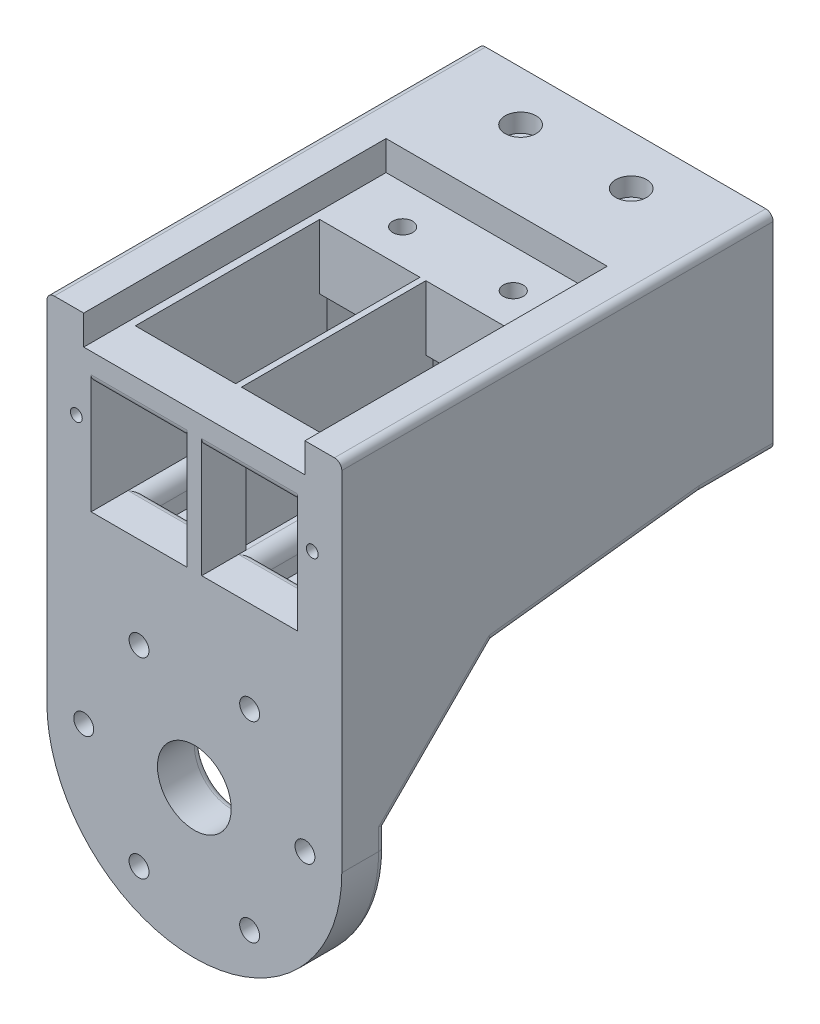
from build123d import *

# Parameters (mm, degrees)
BOSS_EXTRUDE1_DEPTH             = 12
FILLET1_R                       = 40
BOSS_EXTRUDE2_DEPTH             = 105
BOSS_EXTRUDE3_REACH             = 158.228
BOSS_EXTRUDE3_DIRECTION_2_REACH = 158.228
BOSS_EXTRUDE8_START             = 25
BOSS_EXTRUDE8_DEPTH             = 10
BOSS_EXTRUDE9_START             = -25
BOSS_EXTRUDE9_DEPTH             = 10
BOSS_EXTRUDE6_START             = 35
BOSS_EXTRUDE6_DEPTH             = 5
BOSS_EXTRUDE7_START             = -35
BOSS_EXTRUDE7_DEPTH             = 5
SKETCH7_W                       = 60.00000000000001
SKETCH7_H                       = 81.99999999999999
CUT_EXTRUDE3_DEPTH              = 8
CUT_EXTRUDE5_DEPTH              = 7.5
SKETCH8_R                       = 2.699999999999986
SKETCH8_R_2                     = 2.6999999999999957
SKETCH8_R_3                     = 2.700000000000001
SKETCH8_R_4                     = 2.699999999999998
CUT_EXTRUDE4_DEPTH              = 15.5
SKETCH10_R                      = 4.199999999999992
SKETCH10_R_2                    = 4.19999999999999
CUT_EXTRUDE6_DEPTH              = 5
SKETCH12_W                      = 2.200000000000003
SKETCH12_H                      = 30.199999999999996
BOSS_EXTRUDE4_DEPTH             = 52
BOSS_EXTRUDE5_START             = -53
BOSS_EXTRUDE5_DEPTH             = 2
CUT_EXTRUDE7_DEPTH              = 105
CUT_EXTRUDE8_DEPTH              = 157.22780599660004
SKETCH22_R                      = 1.6000000000000016
SKETCH22_R_2                    = 1.599999999999998
CUT_EXTRUDE9_DEPTH              = 5
CUT_EXTRUDE1_DEPTH              = 4
SKETCH6_R                       = 2.700000000000001
SKETCH6_R_2                     = 2.699999999999999
SKETCH6_R_3                     = 2.700000000000006
SKETCH6_R_4                     = 9.999999999999998
CUT_EXTRUDE2_DEPTH              = 157.22780599660004
FILLET3_5MM_R                   = 5
FILLET2_2MM_R                   = 2
FILLET5_4MM_START               = -106
FILLET5_4MM_DEPTH               = 108
FILLET5_4MM_START_2             = -29
FILLET5_4MM_2_DEPTH             = 58


with BuildPart() as part:
    # Sketch1 → Boss-Extrude1 (new body)
    with BuildSketch(Plane.XY):
        Polygon((-40, 27.954491725768317), (40, 27.954491725768328), (40.00000000000001, -108.54550827423168), (-39.99999999999998, -108.5455082742317), align=None)
    extrude(amount=BOSS_EXTRUDE1_DEPTH)

    # Fillet1
    fillet1_edges = [part.edges().sort_by_distance(p)[0] for p in [
        (-39.99999999999998, -108.5455082742317, 6),
        (40.00000000000001, -108.54550827423168, 6),
    ]]
    fillet(fillet1_edges, radius=FILLET1_R - 0.0001)  # a hair under: the kernel refuses the full size

    # Sketch3 → Boss-Extrude2 (add)
    with BuildSketch(Plane(origin=(0, 0, 0), x_dir=(-1, 0, 0), z_dir=(0, 0, -1))):
        Polygon((-40, 27.954491725768328), (39.99999999999999, 27.954491725768328), (39.99999999999999, -28.045508274231672), (-39.99999999999999, -28.045508274231672), align=None)
        Polygon((-30.199999999999996, 12.454491725768328), (30.200000000000003, 12.454491725768335), (30.200000000000003, -17.74550827423166), (-30.19999999999999, -17.745508274231668), align=None, mode=Mode.SUBTRACT)
    extrude(amount=BOSS_EXTRUDE2_DEPTH)

    # Boss-Extrude3: up to this face of the body (flat: up to its plane)
    boss_extrude3_end = Plane(part.part.faces().sort_by_distance((40, -3.377360818, -42.874671974))[0])
    # Sketch4 → Boss-Extrude3 (add, up to the picked face)
    with BuildSketch(Plane(origin=(0, 0, 0), x_dir=(0, 0, -1), z_dir=(1, 0, 0)), mode=Mode.PRIVATE) as boss_extrude3_sk1:
        Polygon((0, -28.045508274231672), (1.29e-15, -38.04550827423167), (84.99999999999999, -28.045508274231672), align=None)
    boss_extrude3_tool1 = split(extrude(boss_extrude3_sk1.sketch, amount=BOSS_EXTRUDE3_REACH, mode=Mode.PRIVATE), bisect_by=boss_extrude3_end, keep=Keep.BOTH, mode=Mode.PRIVATE)
    add(boss_extrude3_tool1.solids().sort_by(Axis((0, -31.378842, -28.333333), (1, 0, 0)))[0])

    # Boss-Extrude3 direction 2: up to this face of the body (flat: up to its plane)
    boss_extrude3_direction_2_end = Plane(part.part.faces().sort_by_distance((-40, -3.377360818, -42.874671974))[0])
    # Sketch4 → Boss-Extrude3 direction 2 (add, up to the picked face)
    with BuildSketch(Plane(origin=(0, 0, 0), x_dir=(0, 0, -1), z_dir=(1, 0, 0)), mode=Mode.PRIVATE) as boss_extrude3_direction_2_sk1:
        Polygon((0, -28.045508274231672), (1.29e-15, -38.04550827423167), (84.99999999999999, -28.045508274231672), align=None)
    boss_extrude3_direction_2_tool1 = split(extrude(boss_extrude3_direction_2_sk1.sketch, amount=-BOSS_EXTRUDE3_DIRECTION_2_REACH, mode=Mode.PRIVATE), bisect_by=boss_extrude3_direction_2_end, keep=Keep.BOTH, mode=Mode.PRIVATE)
    add(boss_extrude3_direction_2_tool1.solids().sort_by(Axis((0, -31.378842, -28.333333), (-1, 0, 0)))[0])

    # Sketch20 → Boss-Extrude8 (add)
    with BuildSketch(Plane(origin=(0, 0, 0), x_dir=(0, 0, -1), z_dir=(1, 0, 0)).offset(BOSS_EXTRUDE8_START)):
        Polygon((1.29e-15, -38.04550827423167), (23.233333333333075, -35.312174940898366), (0, -58.54550827423169), align=None)
    extrude(amount=BOSS_EXTRUDE8_DEPTH)

    # Sketch20<2> → Boss-Extrude9 (add)
    with BuildSketch(Plane(origin=(0, 0, 0), x_dir=(0, 0, -1), z_dir=(1, 0, 0)).offset(BOSS_EXTRUDE9_START)):
        Polygon((1.29e-15, -38.04550827423167), (23.233333333333075, -35.312174940898366), (0, -58.54550827423169), align=None)
    extrude(amount=-BOSS_EXTRUDE9_DEPTH)

    # Sketch18 → Boss-Extrude6 (add)
    with BuildSketch(Plane(origin=(0, 0, 0), x_dir=(0, 0, -1), z_dir=(1, 0, 0)).offset(BOSS_EXTRUDE6_START)):
        Polygon((1.29e-15, -38.04550827423167), (28.899999999999633, -34.64550827423171), (0, -63.545508274231665), align=None)
    extrude(amount=BOSS_EXTRUDE6_DEPTH)

    # Sketch18<2> → Boss-Extrude7 (add)
    with BuildSketch(Plane(origin=(0, 0, 0), x_dir=(0, 0, -1), z_dir=(1, 0, 0)).offset(BOSS_EXTRUDE7_START)):
        Polygon((1.29e-15, -38.04550827423167), (28.899999999999633, -34.64550827423171), (0, -63.545508274231665), align=None)
    extrude(amount=-BOSS_EXTRUDE7_DEPTH)

    # Sketch7 → Cut-Extrude3 (cut)
    with BuildSketch(Plane(origin=(-3.64e-15, 27.954491725768325, 0), x_dir=(1, 1.3e-16, 0), z_dir=(-1.3e-16, 1, 0))):
        with Locations((0, 28.999999999999993)):
            Rectangle(SKETCH7_W, SKETCH7_H)
    extrude(amount=-CUT_EXTRUDE3_DEPTH, mode=Mode.SUBTRACT)

    # Sketch9 → Cut-Extrude5 (cut)
    with BuildSketch(Plane(origin=(-2.31e-15, 19.954491725768325, 0), x_dir=(1, 1.2e-16, 0), z_dir=(-1.2e-16, 1, 0))):
        Polygon((0.8, 52.00000000000001), (27.999999999999996, 52), (27.999999999999996, -3.33e-15), (0.7999999999999999, 3.6e-16), align=None)
        Polygon((-0.7999999999999999, 3.6e-16), (-27.999999999999996, -3.33e-15), (-27.999999999999996, 52), (-0.8, 52.00000000000001), align=None)
    extrude(amount=-CUT_EXTRUDE5_DEPTH, mode=Mode.SUBTRACT)

    # Sketch8 → Cut-Extrude4 (cut)
    with BuildSketch(Plane(origin=(-3.64e-15, 27.954491725768325, 0), x_dir=(1, 1.3e-16, 0), z_dir=(-1.3e-16, 1, 0))):
        with Locations(Location((-14.999999999999996, 91.5, 0), (0, 0, 180))):
            Circle(SKETCH8_R)
        with Locations(Location((15.000000000000004, 91.5, 0), (0, 0, 180))):
            Circle(SKETCH8_R_2)
        with Locations((-15.000000000000004, 59.5)):
            Circle(SKETCH8_R_3)
        with Locations((15.000000000000004, 59.5)):
            Circle(SKETCH8_R_4)
    extrude(amount=-CUT_EXTRUDE4_DEPTH, mode=Mode.SUBTRACT)

    # Sketch10 → Cut-Extrude6 (cut)
    with BuildSketch(Plane(origin=(-3.64e-15, 27.954491725768325, 0), x_dir=(1, 1.3e-16, 0), z_dir=(-1.3e-16, 1, 0))):
        with Locations(Location((-14.999999999999996, 91.5, 0), (0, 0, 180))):
            Circle(SKETCH10_R)
        with Locations(Location((15.000000000000004, 91.5, 0), (0, 0, 180))):
            Circle(SKETCH10_R_2)
    extrude(amount=-CUT_EXTRUDE6_DEPTH, mode=Mode.SUBTRACT)

    # Sketch12 → Boss-Extrude4 (add)
    with BuildSketch(Plane(origin=(0, 0, 0), x_dir=(-1, 0, 0), z_dir=(0, 0, -1))):
        Polygon((30.200000000000003, 12.454491725768335), (28, 12.454491725768335), (28.000000000000007, -17.745508274231668), (30.200000000000003, -17.74550827423166), align=None)
        with Locations((-29.099999999999994, -2.64550827423167)):
            Rectangle(SKETCH12_W, SKETCH12_H)
        Polygon((-0.8000000000000036, 12.454491725768335), (0.8000000000000036, 12.454491725768335), (0.8, -17.745508274231668), (-0.8, -17.745508274231668), align=None)
    extrude(amount=BOSS_EXTRUDE4_DEPTH)

    # Sketch16 → Boss-Extrude5 (add)
    with BuildSketch(Plane(origin=(0, 0, -105), x_dir=(-1, 0, 0), z_dir=(0, 0, -1)).offset(BOSS_EXTRUDE5_START)):
        Polygon((-30.199999999999996, 12.454491725768328), (-30.2, 2.4544917257683285), (28, 2.4544917257683285), (28, 12.454491725768328), (28, 19.954491725768328), (-30.2, 19.954491725768328), align=None)
    extrude(amount=-BOSS_EXTRUDE5_DEPTH)

    # Sketch13 → Cut-Extrude7 (cut)
    with BuildSketch(Plane(origin=(0, 0, -105), x_dir=(-1, 0, 0), z_dir=(0, 0, -1))):
        Polygon((-23.999999999999996, -17.745508274231668), (-6.000000000000005, -17.745508274231664), (-5.999999999999998, -26.045508274231665), (-23.999999999999996, -26.04550827423167), align=None)
        Polygon((24.000000000000004, -26.04550827423166), (6.000000000000005, -26.045508274231665), (6.000000000000005, -17.745508274231664), (23.999999999999996, -17.745508274231668), align=None)
    extrude(amount=-CUT_EXTRUDE7_DEPTH, mode=Mode.SUBTRACT)

    # Sketch17 → Cut-Extrude8 (cut, through all)
    with BuildSketch(Plane(origin=(0, 0, 0), x_dir=(-1, 0, 0), z_dir=(0, 0, -1))):
        Polygon((-27.999999999999996, 12.454491725768335), (-2.0000000000000053, 12.454491725768335), (-1.9999999999999982, -17.74550827423166), (-27.999999999999996, -17.74550827423166), align=None)
        Polygon((27.999999999999996, -17.74550827423166), (1.9999999999999982, -17.74550827423166), (2.0000000000000053, 12.454491725768335), (27.999999999999996, 12.454491725768335), align=None)
    extrude(amount=-CUT_EXTRUDE8_DEPTH, mode=Mode.SUBTRACT)

    # Sketch22 → Cut-Extrude9 (cut)
    with BuildSketch(Plane.XY.offset(12)):
        with Locations((-32, 3)):
            Circle(SKETCH22_R)
        with Locations(Location((32, 3.000000000000008, 0), (0, 0, 180))):
            Circle(SKETCH22_R_2)
    extrude(amount=-CUT_EXTRUDE9_DEPTH, mode=Mode.SUBTRACT)

    # Sketch5 → Cut-Extrude1 (cut)
    with BuildSketch(Plane(origin=(0, 0, 0), x_dir=(-1, 0, 0), z_dir=(0, 0, -1))):
        Polygon((12.603996382862979, -90.37627038776493), (17.396003617136877, -90.37627038776493), (19.792007234273804, -94.5262703877649), (17.39600361713687, -98.67627038776489), (12.603996382862988, -98.67627038776489), (10.207992765726049, -94.5262703877649), align=None)
        Polygon((-12.603996382863187, -38.41474616069861), (-17.396003617137076, -38.41474616069861), (-19.792007234274017, -42.564746160698604), (-17.396003617137065, -46.71474616069861), (-12.603996382863185, -46.71474616069861), (-10.20799276572624, -42.56474616069861), align=None)
        Polygon((-27.603996382863073, -64.39550827423172), (-32.39600361713695, -64.39550827423172), (-34.79200723427389, -68.54550827423171), (-32.39600361713695, -72.6955082742317), (-27.603996382863087, -72.6955082742317), (-25.207992765726136, -68.54550827423168), align=None)
        Polygon((-17.39600361713689, -90.37627038776493), (-19.792007234273825, -94.5262703877649), (-17.39600361713689, -98.67627038776489), (-12.603996382863011, -98.67627038776489), (-10.20799276572607, -94.5262703877649), (-12.603996382862999, -90.37627038776493), align=None)
        Polygon((10.20799276572624, -42.56474616069862), (12.60399638286319, -38.41474616069862), (17.396003617137083, -38.41474616069862), (19.792007234274024, -42.564746160698604), (17.396003617137065, -46.71474616069862), (12.603996382863185, -46.71474616069862), align=None)
        Polygon((25.20799276572613, -68.5455082742317), (27.603996382863066, -64.39550827423173), (32.396003617136934, -64.39550827423173), (34.792007234273875, -68.54550827423172), (32.396003617136934, -72.69550827423171), (27.60399638286308, -72.69550827423171), align=None)
    extrude(amount=-CUT_EXTRUDE1_DEPTH, mode=Mode.SUBTRACT)

    # Sketch6 → Cut-Extrude2 (cut, through all)
    with BuildSketch(Plane(origin=(0, 0, 0), x_dir=(-1, 0, 0), z_dir=(0, 0, -1))):
        with Locations((-15.000000000000131, -42.56474616069861)):
            Circle(SKETCH6_R)
        with Locations((-30.000000000000004, -68.5455082742317)):
            Circle(SKETCH6_R_2)
        with Locations((-15.000000000000135, -94.52627038776478)):
            Circle(SKETCH6_R_3)
        with Locations(Location((15.000000000000117, -94.52627038776478, 0), (0, 0, 180))):
            Circle(SKETCH6_R_2)
        with Locations(Location((29.999999999999996, -68.5455082742317, 0), (0, 0, 180))):
            Circle(SKETCH6_R_2)
        with Locations(Location((15.00000000000012, -42.56474616069861, 0), (0, 0, 180))):
            Circle(SKETCH6_R)
        with Locations((-4.91e-15, -68.5455082742317)):
            Circle(SKETCH6_R_4)
    extrude(amount=-CUT_EXTRUDE2_DEPTH, mode=Mode.SUBTRACT)

    # Fillet3-5mm
    # the kernel refuses this fillet: 5 mm, written as the material it adds along each edge
    with BuildSketch(Plane(origin=(-35, -26.86096588181112, -31.684542392420234), x_dir=(1, 3.7e-16, 3.7e-16), z_dir=(0, -0.7071067811865513, 0.7071067811865437))) as fillet3_5mm_piece_1_section:
        with BuildLine():
            CenterArc((4.7807257879245935, -4.999999999999997), FILLET3_5MM_R, 89.99999999999999, 72.96875154177606)
            Line((-1.86e-15, -3.5355339059326925), (0, 0))
            Line((0, 0), (4.780725787924595, 0))
        make_face()
    fillet3_5mm_piece_1 = extrude(amount=56.760524038757694, mode=Mode.PRIVATE)
    fillet3_5mm_piece_1 = split(fillet3_5mm_piece_1, bisect_by=Plane(origin=(-35, -26.86096588181112, 0), z_dir=(0, 0, -1)), keep=Keep.TOP, mode=Mode.PRIVATE)
    add(fillet3_5mm_piece_1)
    with BuildSketch(Plane(origin=(35, -26.86096588181112, -31.684542392420234), x_dir=(0, -0.7071067811865438, -0.7071067811865512), z_dir=(0, -0.7071067811865513, 0.7071067811865437))) as fillet3_5mm_piece_2_section:
        with BuildLine():
            CenterArc((4.999999999999996, -4.780725787924595), FILLET3_5MM_R, 107.03124845822393, 72.96875154177607)
            Line((-2.51e-15, -4.780725787924595), (0, 0))
            Line((0, 0), (3.5355339059326925, 0))
        make_face()
    fillet3_5mm_piece_2 = extrude(amount=56.760524038757694, mode=Mode.PRIVATE)
    fillet3_5mm_piece_2 = split(fillet3_5mm_piece_2, bisect_by=Plane(origin=(35, -26.86096588181112, 0), z_dir=(0, 0, -1)), keep=Keep.TOP, mode=Mode.PRIVATE)
    add(fillet3_5mm_piece_2)
    # the kernel refuses this fillet: 5 mm, written as the material it takes off along each edge
    with BuildSketch(Plane(origin=(-25, -26.473340176066472, -32.07216809816487), x_dir=(0, 0.7071067811865437, 0.7071067811865513), z_dir=(0, -0.7071067811865513, 0.7071067811865437))) as fillet3_5mm_2_piece_1_section:
        with BuildLine():
            CenterArc((FILLET3_5MM_R, FILLET3_5MM_R), FILLET3_5MM_R, 180, 90)
            Line((0, FILLET3_5MM_R), (0, 0))
            Line((0, 0), (FILLET3_5MM_R, 0))
        make_face()
    fillet3_5mm_2_piece_1 = extrude(amount=57.85689509913472, mode=Mode.PRIVATE)
    fillet3_5mm_2_piece_1 = split(fillet3_5mm_2_piece_1, bisect_by=Plane(origin=(-25, -26.473340176066472, 0), z_dir=(0, 0, -1)), keep=Keep.TOP, mode=Mode.PRIVATE)
    fillet3_5mm_2_piece_1 = split(fillet3_5mm_2_piece_1, bisect_by=Plane(origin=(-25, -34.165841421909946, -32.97716824473469), z_dir=(0, -0.9931506043228763, -0.11684124756739722)), keep=Keep.TOP, mode=Mode.PRIVATE)
    add(fillet3_5mm_2_piece_1, mode=Mode.SUBTRACT)
    with BuildSketch(Plane(origin=(25, -26.473340176066472, -32.07216809816487), x_dir=(1, 7.1e-16, 7.1e-16), z_dir=(0, -0.7071067811865513, 0.7071067811865437))) as fillet3_5mm_2_piece_2_section:
        with BuildLine():
            CenterArc((FILLET3_5MM_R, FILLET3_5MM_R), FILLET3_5MM_R, 179.99999999999994, 90)
            Line((5.02e-15, FILLET3_5MM_R), (0, 0))
            Line((0, 0), (FILLET3_5MM_R, 0))
        make_face()
    fillet3_5mm_2_piece_2 = extrude(amount=57.85689509913472, mode=Mode.PRIVATE)
    fillet3_5mm_2_piece_2 = split(fillet3_5mm_2_piece_2, bisect_by=Plane(origin=(25, -26.473340176066472, 0), z_dir=(0, 0, -1)), keep=Keep.TOP, mode=Mode.PRIVATE)
    fillet3_5mm_2_piece_2 = split(fillet3_5mm_2_piece_2, bisect_by=Plane(origin=(25, -34.165841421909946, -32.97716824473469), z_dir=(0, -0.9931506043228763, -0.11684124756739722)), keep=Keep.TOP, mode=Mode.PRIVATE)
    add(fillet3_5mm_2_piece_2, mode=Mode.SUBTRACT)

    # Fillet2-2mm
    fillet2_2mm_edges = [part.edges().sort_by_distance(p)[0] for p in [
        (40.00000000000001, -66.04555827423167, 0),
        (28.28430053678379, -96.82980881101545, 0),
        (-28.284300536783775, -96.82980881101547, 0),
        (14.999999999999998, -26.045508274231665, 0),
        (-15.000000000000004, -26.045508274231665, 0),
        (15, 12.454491725768335, 12),
        (15.000000000000002, -17.74550827423166, 0),
        (39.99999999999999, -28.045508274231672, -95),
        (-39.99999999999999, -28.045508274231672, -95),
        (-15.000000000000002, 12.454491725768335, 12),
        (-15, -17.74550827423166, 0),
        (10.000000000000004, -68.5455082742317, 0),
        (40, -31.345508274231694, -56.94999999999981),
        (-40, -31.345508274231694, -56.94999999999982),
        (-40, 27.95449172576832, -46.5),
        (40, 27.954491725768328, -46.5),
        (40, -49.09550827423169, -14.449999999999816),
        (-39.999999999999986, -66.04555827423167, 0),
        (-40, -49.09550827423169, -14.449999999999816),
    ]]
    fillet(fillet2_2mm_edges, radius=FILLET2_2MM_R)

    # Fillet5-4mm: read off the stored shape, not the designer's step
    # Fillet5-4mm outline → Fillet5-4mm (cut)
    with BuildSketch(Plane.XY.offset(FILLET5_4MM_START)):
        with BuildLine():
            Line((-24, -21.745508274), (-24, -17.745508274))
            Line((-24, -17.745508274), (-28, -17.745508274))
            ThreePointArc((-28, -17.745508274), (-25.171572875, -18.917081149), (-24, -21.745508274))
        make_face()
        with BuildLine():
            Line((28, -17.745508274), (24, -17.745508274))
            Line((24, -17.745508274), (24, -21.745508274))
            ThreePointArc((24, -21.745508274), (25.171572875, -18.917081149), (28, -17.745508274))
        make_face()
        with BuildLine():
            Line((6, -17.745508274), (2, -17.745508274))
            ThreePointArc((2, -17.745508274), (4.828427125, -18.917081149), (6, -21.745508274))
            Line((6, -21.745508274), (6, -17.745508274))
        make_face()
        with BuildLine():
            ThreePointArc((-6, -21.745508274), (-4.828427125, -18.917081149), (-2, -17.745508274))
            Line((-2, -17.745508274), (-6, -17.745508274))
            Line((-6, -17.745508274), (-6, -21.745508274))
        make_face()
    extrude(amount=FILLET5_4MM_DEPTH, mode=Mode.SUBTRACT)

    # Fillet5-4mm 2 outline → Fillet5-4mm 2 (add)
    with BuildSketch(Plane.YZ.offset(FILLET5_4MM_START_2)):
        with BuildLine():
            Line((-21.745508274, 0), (-19.745508274, 0))
            ThreePointArc((-19.745508274, 0), (-18.331294712, 0.585786438), (-17.745508274, 2))
            Line((-17.745508274, 2), (-21.745508274, 2))
            Line((-21.745508274, 2), (-21.745508274, 0))
        make_face()
    extrude(amount=FILLET5_4MM_2_DEPTH)


solid = part.part
